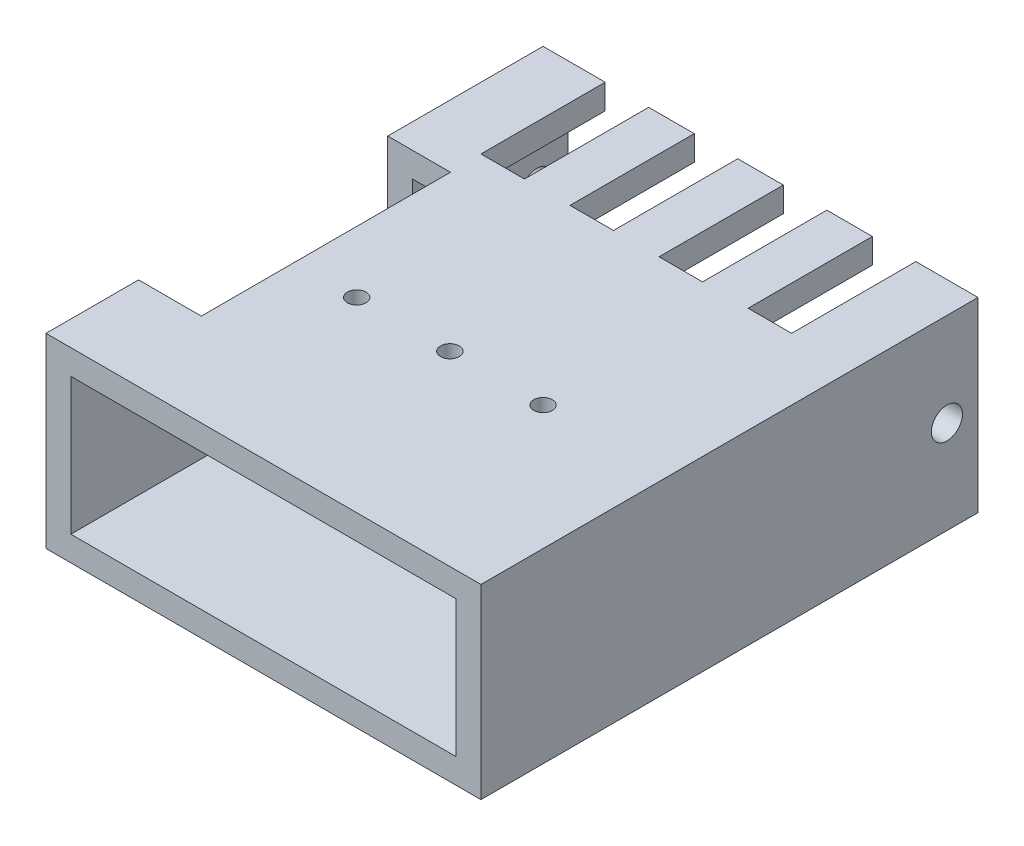
from build123d import *

# Parameters (mm, degrees)
SKETCH1_W               = 88.9
SKETCH1_H               = 101.6
BOSS_EXTRUDE1_DEPTH     = 38.1
SHELL1_T                = -5.08
CUT_EXTRUDE3_START      = -19.05
SKETCH4_W               = 12.827
SKETCH4_H               = 50.927
CUT_EXTRUDE3_DEPTH      = 122.226084918
SKETCH5_W               = 8.89
SKETCH5_H               = 25.4
CUT_EXTRUDE4_DEPTH      = 141.276084918
CUT_EXTRUDE5_DEPTH      = 4.2672
CUT_EXTRUDE5_DEPTH_BACK = 141.276084918
SKETCH6_R               = 3.175
CUT_EXTRUDE6_REACH      = 142.276
SKETCH7_R               = 1.905


with BuildPart() as part:
    # Sketch1 → Boss-Extrude1 (new body)
    with BuildSketch(Plane(origin=(0, 0, 0), x_dir=(1, 0, 0), z_dir=(0, 1, 0))):
        with Locations((44.45, 50.8)):
            Rectangle(SKETCH1_W, SKETCH1_H)
    extrude(amount=BOSS_EXTRUDE1_DEPTH)

    # Shell1
    shell1_openings = [part.faces().sort_by_distance(p)[0] for p in [
        (44.45, 19.05, -101.6),
        (44.45, 19.05, 0),
    ]]
    offset(amount=SHELL1_T, openings=shell1_openings, kind=Kind.INTERSECTION)

    # Sketch4 → Cut-Extrude3 (cut, through all)
    with BuildSketch(Plane.XZ.offset(CUT_EXTRUDE3_START)):
        with Locations((6.4135, -44.3865)):
            Rectangle(SKETCH4_W, SKETCH4_H)
    extrude(amount=-CUT_EXTRUDE3_DEPTH, mode=Mode.SUBTRACT)

    # Sketch5 → Cut-Extrude4 (cut, through all)
    with BuildSketch(Plane(origin=(0, 38.1, 0), x_dir=(1, 0, 0), z_dir=(0, 1, 0))):
        with Locations((17.145, 88.9)):
            Rectangle(SKETCH5_W, SKETCH5_H)
        with Locations((35.348333333, 88.9)):
            Rectangle(SKETCH5_W, SKETCH5_H)
        with Locations((53.551666667, 88.9)):
            Rectangle(SKETCH5_W, SKETCH5_H)
        with Locations((71.755, 88.9)):
            Rectangle(SKETCH5_W, SKETCH5_H)
    extrude(amount=-CUT_EXTRUDE4_DEPTH, mode=Mode.SUBTRACT)

    # Sketch6 → Cut-Extrude5 (cut, two sides: drawn at the far end of the back side and taken through both)
    with BuildSketch(Plane.ZY.offset(-CUT_EXTRUDE5_DEPTH_BACK)):
        with Locations((-95.25, 19.05)):
            Circle(SKETCH6_R)
    extrude(amount=CUT_EXTRUDE5_DEPTH + CUT_EXTRUDE5_DEPTH_BACK, mode=Mode.SUBTRACT)

    # Sketch7 → Cut-Extrude6 (cut, up to next)
    with BuildSketch(Plane(origin=(0, 38.1, 0), x_dir=(1, 0, 0), z_dir=(0, 1, 0)), mode=Mode.PRIVATE) as cut_extrude6_sk1:
        with Locations((44.45, 38.1)):
            Circle(SKETCH7_R)
    cut_extrude6_tool1 = extrude(cut_extrude6_sk1.sketch, amount=-CUT_EXTRUDE6_REACH, mode=Mode.PRIVATE) & part.part
    # Sketch7 → Cut-Extrude6 (cut, up to next)
    with BuildSketch(Plane(origin=(0, 38.1, 0), x_dir=(1, 0, 0), z_dir=(0, 1, 0)), mode=Mode.PRIVATE) as cut_extrude6_sk2:
        with Locations((25.4, 38.1)):
            Circle(SKETCH7_R)
    cut_extrude6_tool2 = extrude(cut_extrude6_sk2.sketch, amount=-CUT_EXTRUDE6_REACH, mode=Mode.PRIVATE) & part.part
    # Sketch7 → Cut-Extrude6 (cut, up to next)
    with BuildSketch(Plane(origin=(0, 38.1, 0), x_dir=(1, 0, 0), z_dir=(0, 1, 0)), mode=Mode.PRIVATE) as cut_extrude6_sk3:
        with Locations((63.5, 38.1)):
            Circle(SKETCH7_R)
    cut_extrude6_tool3 = extrude(cut_extrude6_sk3.sketch, amount=-CUT_EXTRUDE6_REACH, mode=Mode.PRIVATE) & part.part
    add(cut_extrude6_tool1.solids().sort_by_distance((44.45, 38.1, -38.1))[0], mode=Mode.SUBTRACT)
    add(cut_extrude6_tool2.solids().sort_by_distance((25.4, 38.1, -38.1))[0], mode=Mode.SUBTRACT)
    add(cut_extrude6_tool3.solids().sort_by_distance((63.5, 38.1, -38.1))[0], mode=Mode.SUBTRACT)


solid = part.part
